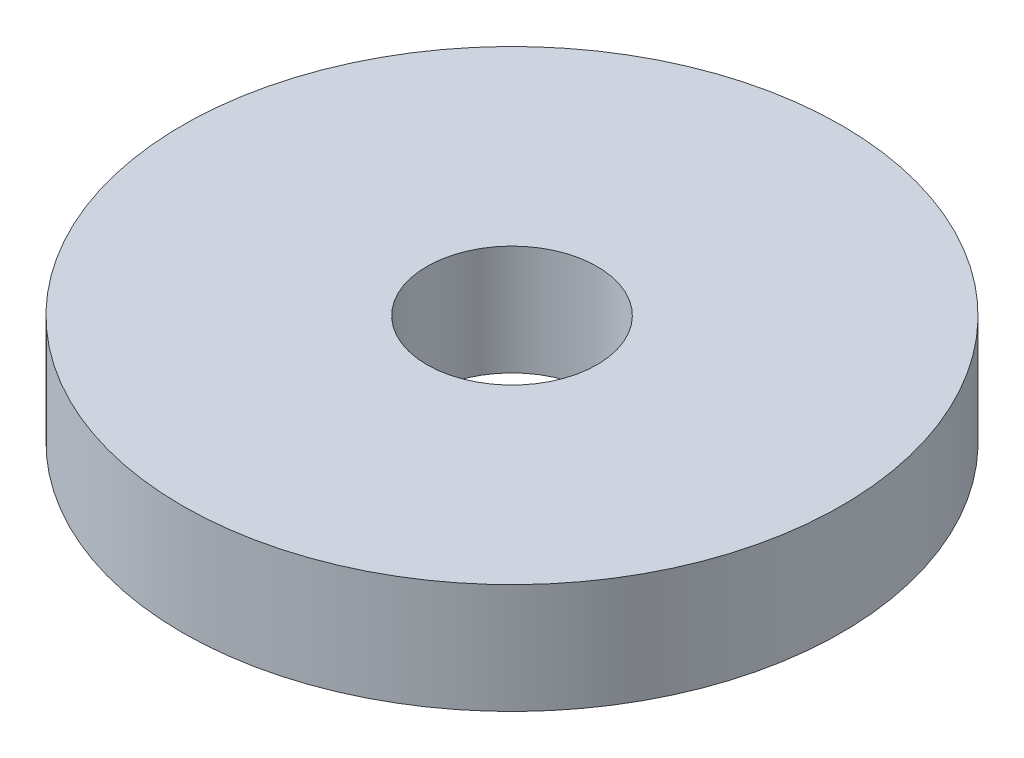
from build123d import *

# Parameters (mm, degrees)
ESBO_O1_R                = 6
ESBO_O1_R_2              = 1.55
RESSALTO_EXTRUS_O1_DEPTH = 2


with BuildPart() as part:
    # Esboço1 → Ressalto-extrusão1 (new body)
    with BuildSketch(Plane(origin=(0, 0, 0), x_dir=(1, 0, 0), z_dir=(0, 1, 0))):
        Circle(ESBO_O1_R)
        Circle(ESBO_O1_R_2, mode=Mode.SUBTRACT)
    extrude(amount=RESSALTO_EXTRUS_O1_DEPTH)


solid = part.part
